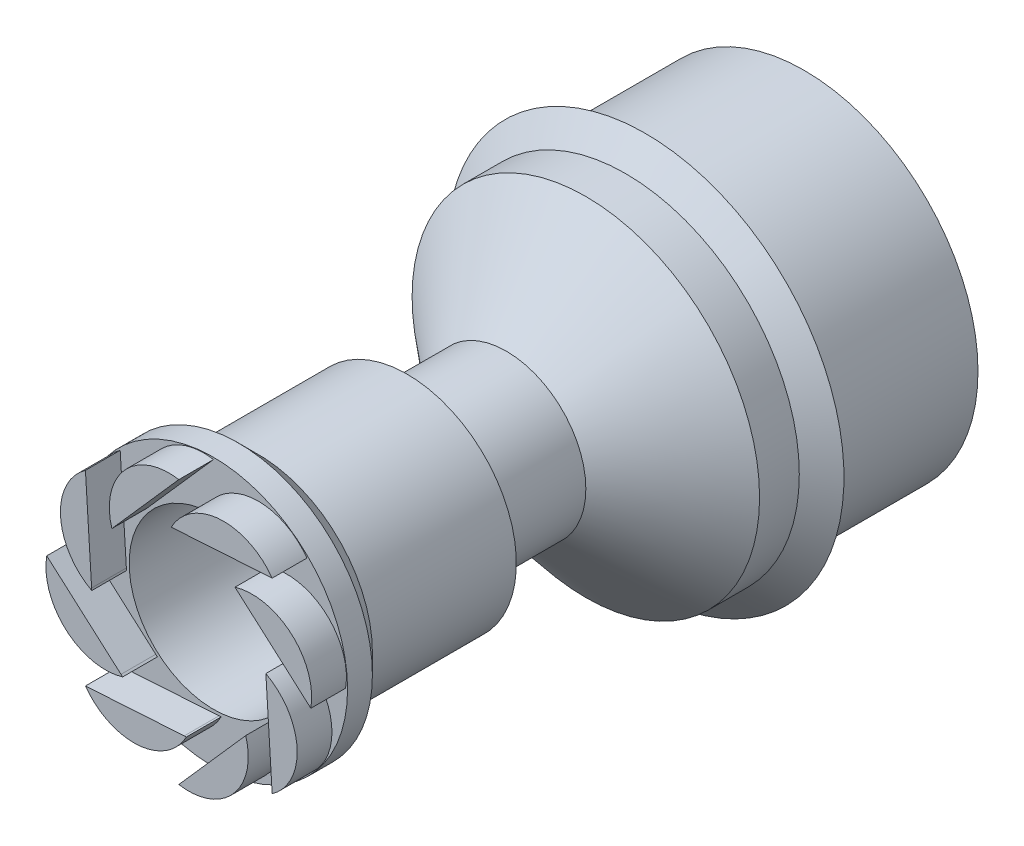
from build123d import *

# Parameters (mm, degrees)
SKETCH_1_R          = 1.75
SKETCH_1_R_2        = 1.65
EXTRUDE_1_DEPTH     = 2.2
SKETCH_10_R         = 0.8
SKETCH_10_R_2       = 0.7
EXTRUDE_2_DEPTH     = 1.2
SKETCH_11_R         = 0.8
SKETCH_11_R_2       = 0.7
EXTRUDE_4_DEPTH     = 0.9
SKETCH_12_W         = 0.3
SKETCH_12_H         = 0.9
SKETCH_13_R         = 0.85
CUT_EXTRUDE_2_DEPTH = 0.5
CHAMFER_1_SIZE      = 0.15
CHAMFER_1_SIZE_2    = 0.259807621
SKETCH_14_R         = 1.1
SKETCH_14_R_2       = 0.85
EXTRUDE_5_DEPTH     = 0.6
SKETCH_15_R         = 1.35
SKETCH_15_R_2       = 1.1
EXTRUDE_6_DEPTH     = 0.8
SKETCH_17_R         = 1.1
SKETCH_17_R_2       = 0.85
EXTRUDE_7_DEPTH     = 0.8
CHAMFER_3_SIZE      = 0.2
CUT_EXTRUDE_START   = -0.35
SKETCH_20_R         = 1.35
SKETCH_20_R_2       = 0.85
CUT_EXTRUDE_4_DEPTH = 0.35


with BuildPart() as part:
    # 스케치1 → 보스-돌출1 (new body)
    with BuildSketch(Plane.XY):
        Circle(SKETCH_1_R)
        Circle(SKETCH_1_R_2, mode=Mode.SUBTRACT)
    extrude(amount=EXTRUDE_1_DEPTH)

    # 스케치2 → 회전1 (revolve)
    with BuildSketch(Plane(origin=(0, 0, 0), x_dir=(1, 0, 0), z_dir=(0, 1, 0)), mode=Mode.PRIVATE) as revolve_1_sk:
        Polygon((2, -1.6), (1.75, -1.8), (1.75, -1.6), align=None)
    revolve(revolve_1_sk.sketch.rotate(Axis((0, 0, 0), (0, 0, 1)), 180), axis=Axis((0, 0, 0), (0, 0, 1)))

    # 스케치3 → 회전2 (revolve)
    with BuildSketch(Plane(origin=(0, 0, 0), x_dir=(1, 0, 0), z_dir=(0, 1, 0)), mode=Mode.PRIVATE) as revolve_2_sk:
        Polygon((0.8, -3), (1.75, -2.2), (1.65, -2.2), (0.8, -2.915789474), align=None)
    revolve(revolve_2_sk.sketch.rotate(Axis((0, 0, 0), (0, 0, 1)), 180), axis=Axis((0, 0, 0), (0, 0, 1)))

    # 스케치10 → 보스-돌출2 (add, symmetric)
    with BuildSketch(Plane(origin=(0, 0, 2.8), x_dir=(-1, 0, 0), z_dir=(0, 0, -1))):
        Circle(SKETCH_10_R)
        Circle(SKETCH_10_R_2, mode=Mode.SUBTRACT)
    extrude(amount=EXTRUDE_2_DEPTH, both=True)

    # 스케치11 → 보스-돌출4 (add)
    with BuildSketch(Plane.XY.offset(4)):
        with Locations(Location((0, 0, 0), (0, 0, 180))):
            Circle(SKETCH_11_R)
        Circle(SKETCH_11_R_2, mode=Mode.SUBTRACT)
    extrude(amount=EXTRUDE_4_DEPTH)

    # 스케치12 → 회전3 (revolve)
    with BuildSketch(Plane(origin=(0, 0, 0), x_dir=(1, 0, 0), z_dir=(0, 1, 0)), mode=Mode.PRIVATE) as revolve_3_sk:
        with Locations((0.95, -4.45)):
            Rectangle(SKETCH_12_W, SKETCH_12_H)
    revolve(revolve_3_sk.sketch.rotate(Axis((0, 0, 0), (0, 0, 1)), 180), axis=Axis((0, 0, 0), (0, 0, 1)))

    # 스케치13 → 컷-돌출2 (cut)
    with BuildSketch(Plane.XY.offset(4.9)):
        Circle(SKETCH_13_R)
    extrude(amount=-CUT_EXTRUDE_2_DEPTH, mode=Mode.SUBTRACT)

    # 모따기1
    # the kernel refuses this chamfer: 0.259807621, 0.15 mm, written as the material it takes off along each edge
    with BuildSketch(Plane(origin=(0, 0, 4.4), x_dir=(1, 0, 0), z_dir=(0, 1, 0))) as chamfer_1_piece_1_section:
        Polygon((0.7 + CHAMFER_1_SIZE, 0), (0.7, CHAMFER_1_SIZE_2), (0.7, 0), align=None)
    chamfer_1_piece_1 = revolve(axis=Axis((0, 0, 4.4), (0, 0, -1)), mode=Mode.PRIVATE)
    chamfer_1_piece_1 = chamfer_1_piece_1 & Plane(origin=(0, 0, 4.267945413), x_dir=(1, 0, 0), z_dir=(0, 0, 1)) * Cylinder(0.85, 4, mode=Mode.PRIVATE)
    add(chamfer_1_piece_1, mode=Mode.SUBTRACT)

    # 스케치14 → 보스-돌출5 (add)
    with BuildSketch(Plane.XY.offset(4.9)):
        with Locations(Location((0, 0, 0), (0, 0, 180))):
            Circle(SKETCH_14_R)
        Circle(SKETCH_14_R_2, mode=Mode.SUBTRACT)
    extrude(amount=EXTRUDE_5_DEPTH)



with BuildPart() as body_2:
    # 스케치15 → 보스-돌출6 (new body)
    with BuildSketch(Plane.XY.offset(5.5)):
        Circle(SKETCH_15_R)
        with Locations(Location((0, 0, 0), (0, 0, 180))):
            Circle(SKETCH_15_R_2, mode=Mode.SUBTRACT)
    extrude(amount=EXTRUDE_6_DEPTH)


with BuildPart() as part_1:
    add(part.part)

    add(body_2.part)  # 보스-돌출7 merges body 2
    # 스케치17 → 보스-돌출7 (add)
    with BuildSketch(Plane.XY.offset(5.5)):
        with Locations(Location((0, 0, 0), (0, 0, 180))):
            Circle(SKETCH_17_R)
        Circle(SKETCH_17_R_2, mode=Mode.SUBTRACT)
    extrude(amount=EXTRUDE_7_DEPTH)

    # 모따기3
    chamfer_3_edges = [part_1.edges().sort_by_distance(p)[0] for p in [
        (-1.35, 0, 5.5),
    ]]
    chamfer(chamfer_3_edges, length=CHAMFER_3_SIZE)

    # 스케치20 → 컷-돌출4 (cut)
    with BuildSketch(Plane.XY.offset(6.3).offset(CUT_EXTRUDE_START)):
        Circle(SKETCH_20_R)
        Circle(SKETCH_20_R_2, mode=Mode.SUBTRACT)
        with BuildLine():
            Line((-0.940452019, -0.940452019), (0.076720819, -0.876922974))
            ThreePointArc((0.076720819, -0.876922974), (-0.414209233, -1.191386171), (-0.940452019, -0.940452019))
        make_face(mode=Mode.SUBTRACT)
        with BuildLine():
            Line((-1.33, 0), (-0.56582837, -0.674327993))
            ThreePointArc((-0.56582837, -0.674327993), (-1.135327398, -0.549547083), (-1.33, 0))
        make_face(mode=Mode.SUBTRACT)
        with BuildLine():
            Line((0, -1.33), (0.674327993, -0.56582837))
            ThreePointArc((0.674327993, -0.56582837), (0.549547083, -1.135327398), (0, -1.33))
        make_face(mode=Mode.SUBTRACT)
        with BuildLine():
            Line((0.940452019, -0.940452019), (0.876922974, 0.076720819))
            ThreePointArc((0.876922974, 0.076720819), (1.191386171, -0.414209233), (0.940452019, -0.940452019))
        make_face(mode=Mode.SUBTRACT)
        with BuildLine():
            Line((-0.940452019, 0.940452019), (-0.876922974, -0.076720819))
            ThreePointArc((-0.876922974, -0.076720819), (-1.191386171, 0.414209233), (-0.940452019, 0.940452019))
        make_face(mode=Mode.SUBTRACT)
        with BuildLine():
            ThreePointArc((-0.674327993, 0.56582837), (-0.549547083, 1.135327398), (0, 1.33))
            Line((0, 1.33), (-0.674327993, 0.56582837))
        make_face(mode=Mode.SUBTRACT)
        with BuildLine():
            Line((0.940452019, 0.940452019), (-0.076720819, 0.876922974))
            ThreePointArc((-0.076720819, 0.876922974), (0.414209233, 1.191386171), (0.940452019, 0.940452019))
        make_face(mode=Mode.SUBTRACT)
        with BuildLine():
            Line((1.33, 0), (0.56582837, 0.674327993))
            ThreePointArc((0.56582837, 0.674327993), (1.135327398, 0.549547083), (1.33, 0))
        make_face(mode=Mode.SUBTRACT)
    extrude(amount=CUT_EXTRUDE_4_DEPTH, mode=Mode.SUBTRACT)


solid = part_1.part
